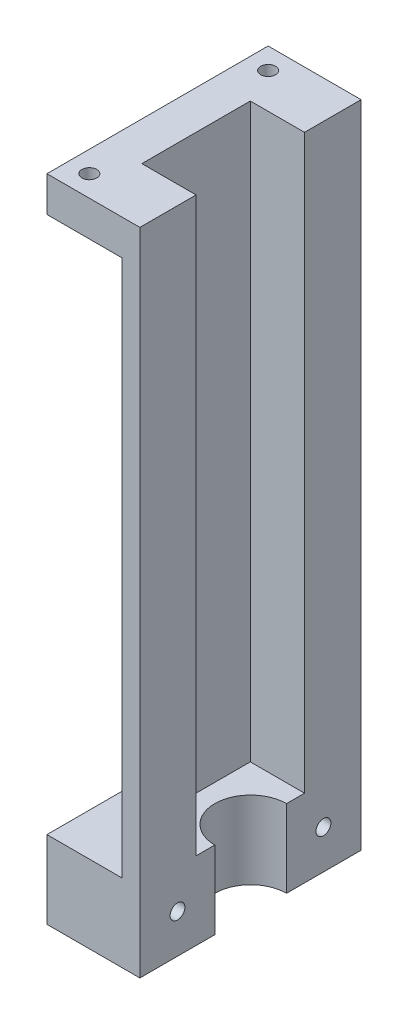
from build123d import *

# Parameters (mm, degrees)
BOSS_EXTRUDE1_DEPTH = 92
BOSS_EXTRUDE2_DEPTH = 11
BOSS_EXTRUDE3_DEPTH = 5
CUT_EXTRUDE1_REACH  = 91.375
SKETCH4_R           = 1.05
BOSS_EXTRUDE4_DEPTH = 11
CUT_EXTRUDE2_DEPTH  = 6.153427125
CUT_EXTRUDE3_REACH  = 96.249
SKETCH7_R           = 1.05
CHAMFER2_SIZE       = 2


with BuildPart() as part:
    # Sketch1 → Boss-Extrude1 (new body)
    with BuildSketch(Plane(origin=(0, 0, 0), x_dir=(1, 0, 0), z_dir=(0, 1, 0))):
        Polygon((0, 15.628427125), (-2.5, 15.628427125), (-13.153427125, 4.975), (-13.153427125, -5.025), (-2.5, -15.678427125), (0, -15.678427125), (0, -7.725), (-7.675, -7.725), (-7.675, 7.625), (0, 7.625), align=None)
    extrude(amount=BOSS_EXTRUDE1_DEPTH)

    # Sketch2 → Boss-Extrude2 (add)
    with BuildSketch(Plane.XZ):
        with BuildLine():
            Line((0, 7.725), (0, 5.075))
            ThreePointArc((0, 5.075), (-5.075, 0), (0, -5.075))
            Line((0, -5.075), (0, -7.625))
            Line((0, -7.625), (-7.675, -7.625))
            Line((-7.675, -7.625), (-7.675, 7.725))
            Line((-7.675, 7.725), (0, 7.725))
        make_face()
    extrude(amount=-BOSS_EXTRUDE2_DEPTH)

    # Sketch3 → Boss-Extrude3 (add)
    with BuildSketch(Plane(origin=(0, 92, 0), x_dir=(1, 0, 0), z_dir=(0, 1, 0))):
        Polygon((-2.5, 15.628427125), (-13.153427125, 15.628427125), (-13.153427125, 4.975), align=None)
        Polygon((-2.5, -15.678427125), (-13.153427125, -15.678427125), (-13.153427125, -5.025), align=None)
    extrude(amount=-BOSS_EXTRUDE3_DEPTH)

    # Sketch4 → Cut-Extrude1 (cut, up to next)
    with BuildSketch(Plane.XZ.offset(-87), mode=Mode.PRIVATE) as cut_extrude1_sk1:
        with Locations(Location((-10.153427125, 12.678427125, 0), (0, 0, 270))):
            Circle(SKETCH4_R)
    cut_extrude1_tool1 = extrude(cut_extrude1_sk1.sketch, amount=-CUT_EXTRUDE1_REACH, mode=Mode.PRIVATE) & part.part
    # Sketch4 → Cut-Extrude1 (cut, up to next)
    with BuildSketch(Plane.XZ.offset(-87), mode=Mode.PRIVATE) as cut_extrude1_sk2:
        with Locations(Location((-10.153427125, -12.628427125, 0), (0, 0, 270))):
            Circle(SKETCH4_R)
    cut_extrude1_tool2 = extrude(cut_extrude1_sk2.sketch, amount=-CUT_EXTRUDE1_REACH, mode=Mode.PRIVATE) & part.part
    add(cut_extrude1_tool1.solids().sort_by_distance((-10.153427, 87, 12.678427))[0], mode=Mode.SUBTRACT)
    add(cut_extrude1_tool2.solids().sort_by_distance((-10.153427, 87, -12.628427))[0], mode=Mode.SUBTRACT)

    # Sketch5 → Boss-Extrude4 (add)
    with BuildSketch(Plane.XZ):
        Polygon((-2.5, 15.678427125), (-13.153427125, 15.678427125), (-13.153427125, 5.025), align=None)
        Polygon((-13.153427125, -4.975), (-13.153427125, -15.628427125), (-2.5, -15.628427125), align=None)
    extrude(amount=-BOSS_EXTRUDE4_DEPTH)

    # Sketch6 → Cut-Extrude2 (cut)
    with BuildSketch(Plane.ZY.offset(13.153427125)):
        Polygon((11.564149128, 7.6), (9.139277997, 7.6), (7.926842432, 5.5), (9.139277997, 3.4), (11.564149128, 3.4), (12.776584693, 5.5), align=None)
        Polygon((-7.876842432, 5.5), (-9.089277997, 7.6), (-11.514149128, 7.6), (-12.726584693, 5.5), (-11.514149128, 3.4), (-9.089277997, 3.4), align=None)
    extrude(amount=-CUT_EXTRUDE2_DEPTH, mode=Mode.SUBTRACT)

    # Sketch7 → Cut-Extrude3 (cut, up to next)
    with BuildSketch(Plane.ZY.offset(13.153427125), mode=Mode.PRIVATE) as cut_extrude3_sk1:
        with Locations((-10.301713562, 5.5)):
            Circle(SKETCH7_R)
    cut_extrude3_tool1 = extrude(cut_extrude3_sk1.sketch, amount=-CUT_EXTRUDE3_REACH, mode=Mode.PRIVATE) & part.part
    # Sketch7 → Cut-Extrude3 (cut, up to next)
    with BuildSketch(Plane.ZY.offset(13.153427125), mode=Mode.PRIVATE) as cut_extrude3_sk2:
        with Locations((10.351713562, 5.5)):
            Circle(SKETCH7_R)
    cut_extrude3_tool2 = extrude(cut_extrude3_sk2.sketch, amount=-CUT_EXTRUDE3_REACH, mode=Mode.PRIVATE) & part.part
    add(cut_extrude3_tool1.solids().sort_by_distance((-13.153427, 5.5, -10.301714))[0], mode=Mode.SUBTRACT)
    add(cut_extrude3_tool2.solids().sort_by_distance((-13.153427, 5.5, 10.351714))[0], mode=Mode.SUBTRACT)

    # Chamfer2
    # the kernel refuses this chamfer: 2 mm, written as the material it takes off along each edge
    with BuildSketch(Plane(origin=(-7, 5.5, 10.351713562), x_dir=(0, 0, 1), z_dir=(0, -1, 0))) as chamfer2_piece_1_section:
        Polygon((1.05, -CHAMFER2_SIZE), (1.05 + CHAMFER2_SIZE, 0), (1.05, 0), align=None)
    chamfer2_piece_1 = revolve(axis=Axis((-7, 5.5, 10.351713562), (-1, 0, 0)), mode=Mode.PRIVATE)
    chamfer2_piece_1 = split(chamfer2_piece_1, bisect_by=Plane(origin=(-5.677336613, 7.282209745, 11.747625417), z_dir=(2.5539348178531628e-15, -0.5000000000000006, -0.8660254037844384)), keep=Keep.TOP, mode=Mode.PRIVATE)
    chamfer2_piece_1 = split(chamfer2_piece_1, bisect_by=Plane(origin=(-5.677336613, 3.717790255, 11.747625417), z_dir=(2.553934817853164e-15, 0.5000000000000003, -0.8660254037844387)), keep=Keep.TOP, mode=Mode.PRIVATE)
    chamfer2_piece_1 = split(chamfer2_piece_1, bisect_by=Plane(origin=(-5.677336613, 3.4, 8.660747588), z_dir=(0, 1, 0)), keep=Keep.TOP, mode=Mode.PRIVATE)
    chamfer2_piece_1 = split(chamfer2_piece_1, bisect_by=Plane(origin=(-5.677336613, 5.182209745, 8.110318721), z_dir=(-2.5539348178531624e-15, 0.5000000000000008, 0.8660254037844383)), keep=Keep.TOP, mode=Mode.PRIVATE)
    chamfer2_piece_1 = split(chamfer2_piece_1, bisect_by=Plane(origin=(-5.677336613, 5.817790255, 8.110318721), z_dir=(-2.5539348178531624e-15, -0.5000000000000007, 0.8660254037844384)), keep=Keep.TOP, mode=Mode.PRIVATE)
    chamfer2_piece_1 = split(chamfer2_piece_1, bisect_by=Plane(origin=(-5.677336613, 7.6, 8.660747588), z_dir=(0, -1, 0)), keep=Keep.TOP, mode=Mode.PRIVATE)
    add(chamfer2_piece_1, mode=Mode.SUBTRACT)
    with BuildSketch(Plane(origin=(-7, 5.5, -10.301713562), x_dir=(0, 0, 1), z_dir=(0, -1, 0))) as chamfer2_piece_2_section:
        Polygon((1.05, -CHAMFER2_SIZE), (1.05 + CHAMFER2_SIZE, 0), (1.05, 0), align=None)
    chamfer2_piece_2 = revolve(axis=Axis((-7, 5.5, -10.301713562), (-1, 0, 0)), mode=Mode.PRIVATE)
    chamfer2_piece_2 = split(chamfer2_piece_2, bisect_by=Plane(origin=(-5.677336613, 3.717790255, -8.905801708), z_dir=(2.5539348178531635e-15, 0.5000000000000004, -0.8660254037844385)), keep=Keep.TOP, mode=Mode.PRIVATE)
    chamfer2_piece_2 = split(chamfer2_piece_2, bisect_by=Plane(origin=(-5.677336613, 3.4, -11.992679537), z_dir=(0, 1, 0)), keep=Keep.TOP, mode=Mode.PRIVATE)
    chamfer2_piece_2 = split(chamfer2_piece_2, bisect_by=Plane(origin=(-5.677336613, 5.182209745, -12.543108404), z_dir=(-2.5539348178531647e-15, 0.49999999999999933, 0.866025403784439)), keep=Keep.TOP, mode=Mode.PRIVATE)
    chamfer2_piece_2 = split(chamfer2_piece_2, bisect_by=Plane(origin=(-5.677336613, 5.817790255, -12.543108404), z_dir=(-2.5539348178531624e-15, -0.5000000000000007, 0.8660254037844384)), keep=Keep.TOP, mode=Mode.PRIVATE)
    chamfer2_piece_2 = split(chamfer2_piece_2, bisect_by=Plane(origin=(-5.677336613, 7.6, -11.992679537), z_dir=(0, -1, 0)), keep=Keep.TOP, mode=Mode.PRIVATE)
    chamfer2_piece_2 = split(chamfer2_piece_2, bisect_by=Plane(origin=(-5.677336613, 7.282209745, -8.905801708), z_dir=(2.553934817853164e-15, -0.5000000000000002, -0.8660254037844386)), keep=Keep.TOP, mode=Mode.PRIVATE)
    add(chamfer2_piece_2, mode=Mode.SUBTRACT)


solid = part.part
